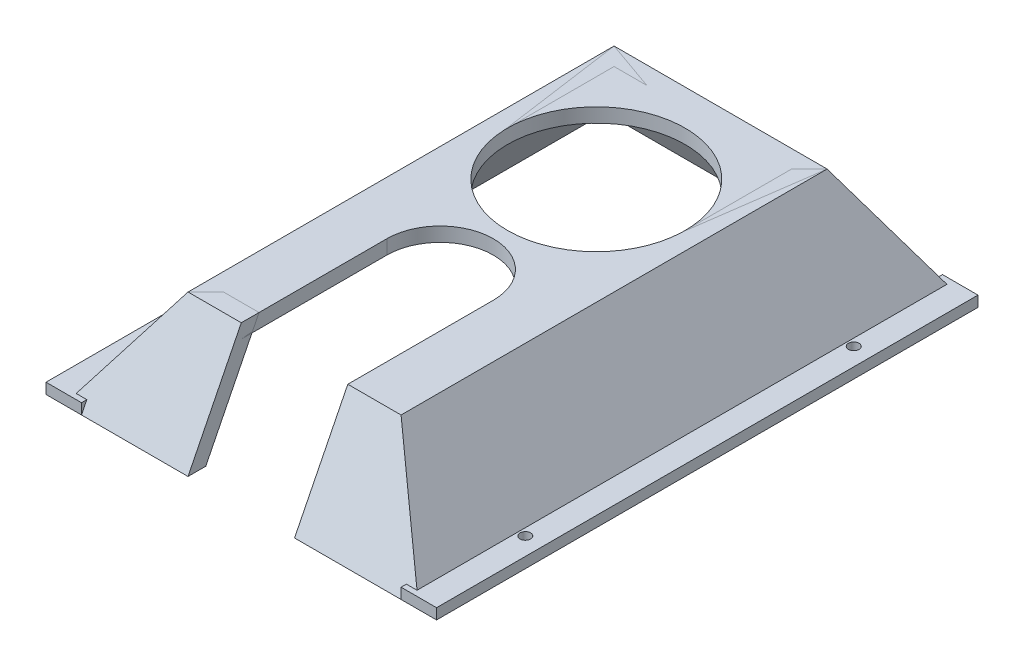
from build123d import *

# Parameters (mm, degrees)
SKETCH6_W             = 10
SKETCH6_H             = 152.5
BOSS_EXTRUDE2_DEPTH   = 3
F_3_0MM_DOWEL_HOLE1_D = 3
SKETCH12_R            = 25
BOSS_EXTRUDE3_DEPTH   = 4
SKETCH13_W            = 30
SKETCH13_H            = 20
CUT_EXTRUDE1_DEPTH    = 30


with BuildPart() as part:
    # Sketch1 → Loft8 section 0
    with BuildSketch(Plane(origin=(0, 0, 0), x_dir=(1, 0, 0), z_dir=(0, 1, 0))):
        with BuildLine():
            Line((-50, 152.5), (50, 152.5))
            Line((50, 152.5), (50, 0))
            Line((50, 0), (-50, 0))
            Line((-50, 0), (-50, 152.5))
        make_face()
    # Sketch3 → Loft8 section 1
    with BuildSketch(Plane(origin=(0, 30, 0), x_dir=(1, 0, 0), z_dir=(0, 1, 0))):
        with BuildLine():
            Line((-30, 135), (30, 135))
            Line((30, 135), (30, 15))
            Line((30, 15), (-30, 15))
            Line((-30, 15), (-30, 135))
        make_face()
    loft()

    # Sketch4 → Cut-Loft1 section 0
    with BuildSketch(Plane(origin=(0, 30, 0), x_dir=(1, 0, 0), z_dir=(0, 1, 0))):
        with BuildLine():
            Line((-25, 130), (25, 130))
            Line((25, 130), (25, 20))
            Line((25, 20), (-25, 20))
            Line((-25, 20), (-25, 130))
        make_face()
    # Sketch5 → Cut-Loft1 section 1
    with BuildSketch(Plane(origin=(0, 0, 0), x_dir=(1, 0, 0), z_dir=(0, 1, 0))):
        with BuildLine():
            Line((-45, 147.5), (45, 147.5))
            Line((45, 147.5), (45, 5))
            Line((45, 5), (-45, 5))
            Line((-45, 5), (-45, 147.5))
        make_face()
    loft(mode=Mode.SUBTRACT)

    # Sketch6 → Boss-Extrude2 (add)
    with BuildSketch(Plane(origin=(0, 0, 0), x_dir=(1, 0, 0), z_dir=(0, 1, 0))):
        Polygon((-45, 0), (-45, 152.5), (-50, 152.5), (-55, 152.5), (-55, 0), (-50, 0), align=None)
        with Locations((50, 76.25)):
            Rectangle(SKETCH6_W, SKETCH6_H)
    extrude(amount=BOSS_EXTRUDE2_DEPTH)

    # Ø3.0mm Dowel Hole1 (through all)
    with Locations(Plane(origin=(0, 3, 0), x_dir=(1, 0, 0), z_dir=(0, 1, 0))):
        with Locations((50, 30), (-50, 30), (-50, 122.5), (50, 122.5)):
            Hole(F_3_0MM_DOWEL_HOLE1_D / 2)

    # Sketch13 → Cut-Extrude1 (cut)
    with BuildSketch(Plane(origin=(0, 30, 0), x_dir=(1, 0, 0), z_dir=(0, 1, 0))):
        with Locations((0, 10)):
            Rectangle(SKETCH13_W, SKETCH13_H)
    extrude(amount=-CUT_EXTRUDE1_DEPTH, mode=Mode.SUBTRACT)


with BuildPart() as body_2:
    # Sketch12 → Boss-Extrude3 (new body)
    with BuildSketch(Plane(origin=(0, 30, 0), x_dir=(1, 0, 0), z_dir=(0, 1, 0))):
        with BuildLine():
            Line((-15, 15), (-15, 56))
            ThreePointArc((-15, 56), (0, 71), (15, 56))
            Line((15, 56), (15, 15))
            Line((15, 15), (30, 15))
            Line((30, 15), (30, 135))
            Line((30, 135), (-30, 135))
            Line((-30, 135), (-30, 15))
            Line((-30, 15), (-15, 15))
        make_face()
        with Locations((0, 100)):
            Circle(SKETCH12_R, mode=Mode.SUBTRACT)
    extrude(amount=-BOSS_EXTRUDE3_DEPTH)


solid = Compound([part.part, body_2.part])
